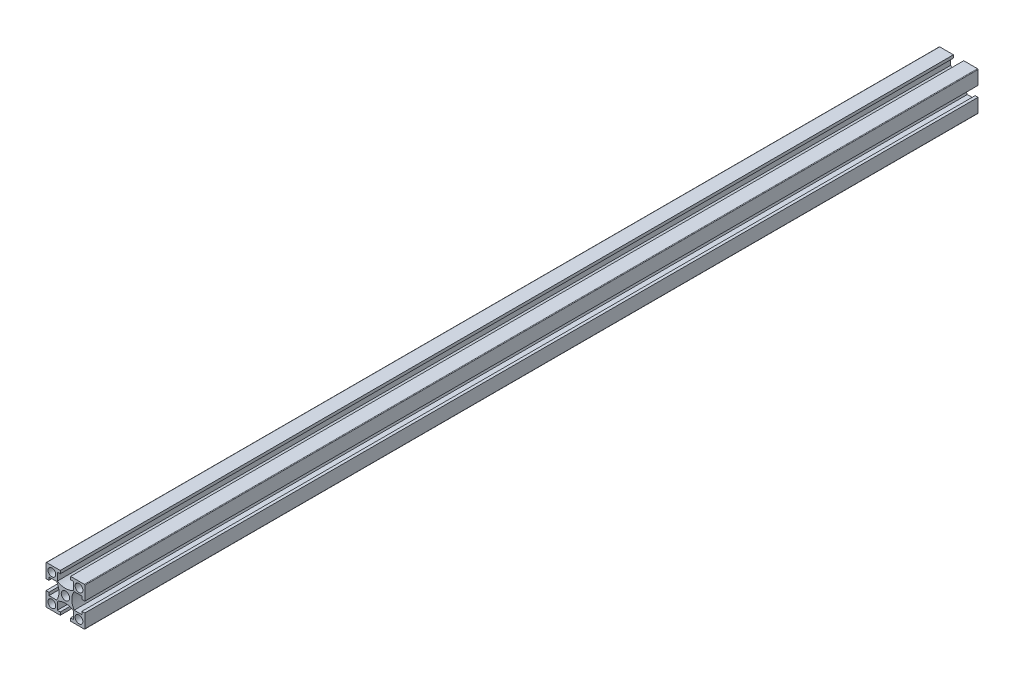
from build123d import *

# Parameters (mm, degrees)
SKETCH_1_W               = 20
SKETCH_1_H               = 20
SKETCH_1_R               = 2
SKETCH_1_R_2             = 2.15
EXTRUDE_1_DEPTH          = 460
CUT_EXTRUDE_1_REACH      = 462.217
PATTERN_CIRCULAR_1_COUNT = 4
FILLET_1_R               = 0.3
SKETCH_2_R               = 2.5
CUT_EXTRUDE_2_DEPTH      = 461.543157587
SKETCH_3_R               = 2.15
CUT_EXTRUDE_3_DEPTH      = 461.543157687
SKETCH_4_R               = 2.15
CUT_EXTRUDE_4_DEPTH      = 461.543157687
SKETCH_5_R               = 2.5
CUT_EXTRUDE_5_DEPTH      = 461.543157687
SKETCH_6_R               = 2.5
CUT_EXTRUDE_9_DEPTH      = 7


with BuildPart() as part:
    # 스케치1 → 보스-돌출1 (new body)
    with BuildSketch(Plane.XY):
        Rectangle(SKETCH_1_W, SKETCH_1_H)
        with Locations((-7, -7)):
            Circle(SKETCH_1_R, mode=Mode.SUBTRACT)
        with Locations((7, -7)):
            Circle(SKETCH_1_R, mode=Mode.SUBTRACT)
        with Locations((-7, 7)):
            Circle(SKETCH_1_R, mode=Mode.SUBTRACT)
        Circle(SKETCH_1_R_2, mode=Mode.SUBTRACT)
        with Locations((7, 7)):
            Circle(SKETCH_1_R, mode=Mode.SUBTRACT)
    extrude(amount=EXTRUDE_1_DEPTH)

    # 스케치1<3> → 컷-돌출1 (cut, up to next)
    with BuildSketch(Plane.XY, mode=Mode.PRIVATE) as cut_extrude_1_sk1:
        with BuildLine():
            Line((-8.5, 2.65), (-10, 2.65))
            Line((-10, 2.65), (-10, -2.65))
            Line((-10, -2.65), (-8.5, -2.65))
            Line((-8.5, -2.65), (-8.5, -4.15))
            Line((-8.5, -4.15), (-4.503166667, -4.15))
            ThreePointArc((-4.503166667, -4.15), (-3.3, 0), (-4.503166667, 4.15))
            Line((-4.503166667, 4.15), (-8.5, 4.15))
            Line((-8.5, 4.15), (-8.5, 2.65))
        make_face()
    cut_extrude_1_tool1 = extrude(cut_extrude_1_sk1.sketch, amount=CUT_EXTRUDE_1_REACH, mode=Mode.PRIVATE) & part.part
    cut_extrude_1 = cut_extrude_1_tool1.solids().sort_by_distance((-6.606913, 0, 0))[0]
    add(cut_extrude_1, mode=Mode.SUBTRACT)

    # 원형 패턴1: 컷-돌출1 ×4 about axis
    pattern_circular_1_axis = Axis((0, 0, 460), (0, 0, -1))
    for i in range(1, PATTERN_CIRCULAR_1_COUNT):
        add(cut_extrude_1.rotate(pattern_circular_1_axis, i * 360 / PATTERN_CIRCULAR_1_COUNT), mode=Mode.SUBTRACT)

    # 필렛1
    fillet_1_edges = [part.edges().sort_by_distance(p)[0] for p in [
        (10, -10, 230),
        (-10, -10, 230),
        (-10, 10, 230),
        (10, 10, 230),
    ]]
    fillet(fillet_1_edges, radius=FILLET_1_R)

    # 스케치2 → 컷-돌출2 (cut, through all)
    with BuildSketch(Plane.ZY.offset(10)):
        with Locations((31, 0)):
            Circle(SKETCH_2_R)
        with Locations((429, 0)):
            Circle(SKETCH_2_R)
    extrude(amount=-CUT_EXTRUDE_2_DEPTH, mode=Mode.SUBTRACT)

    # 스케치3 → 컷-돌출3 (cut, through all)
    with BuildSketch(Plane(origin=(0, 10, 0), x_dir=(1, 0, 0), z_dir=(0, 1, 0))):
        with Locations((0, -10)):
            Circle(SKETCH_3_R)
        with Locations((0, -450)):
            Circle(SKETCH_3_R)
    extrude(amount=-CUT_EXTRUDE_3_DEPTH, mode=Mode.SUBTRACT)

    # 스케치4 → 컷-돌출4 (cut, through all)
    with BuildSketch(Plane.ZY.offset(10)):
        with Locations((10, 0)):
            Circle(SKETCH_4_R)
        with Locations((450, 0)):
            Circle(SKETCH_4_R)
    extrude(amount=-CUT_EXTRUDE_4_DEPTH, mode=Mode.SUBTRACT)

    # 스케치5 → 컷-돌출5 (cut, through all)
    with BuildSketch(Plane.ZY.offset(10)):
        with Locations((190.5, 0)):
            Circle(SKETCH_5_R)
        with Locations((269.5, 0)):
            Circle(SKETCH_5_R)
    extrude(amount=-CUT_EXTRUDE_5_DEPTH, mode=Mode.SUBTRACT)

    # 스케치6 → 컷-돌출9 (cut)
    with BuildSketch(Plane.XZ.offset(10)):
        with Locations((0, 190.5)):
            Circle(SKETCH_6_R)
        with Locations((0, 269.5)):
            Circle(SKETCH_6_R)
    extrude(amount=-CUT_EXTRUDE_9_DEPTH, mode=Mode.SUBTRACT)


solid = part.part
